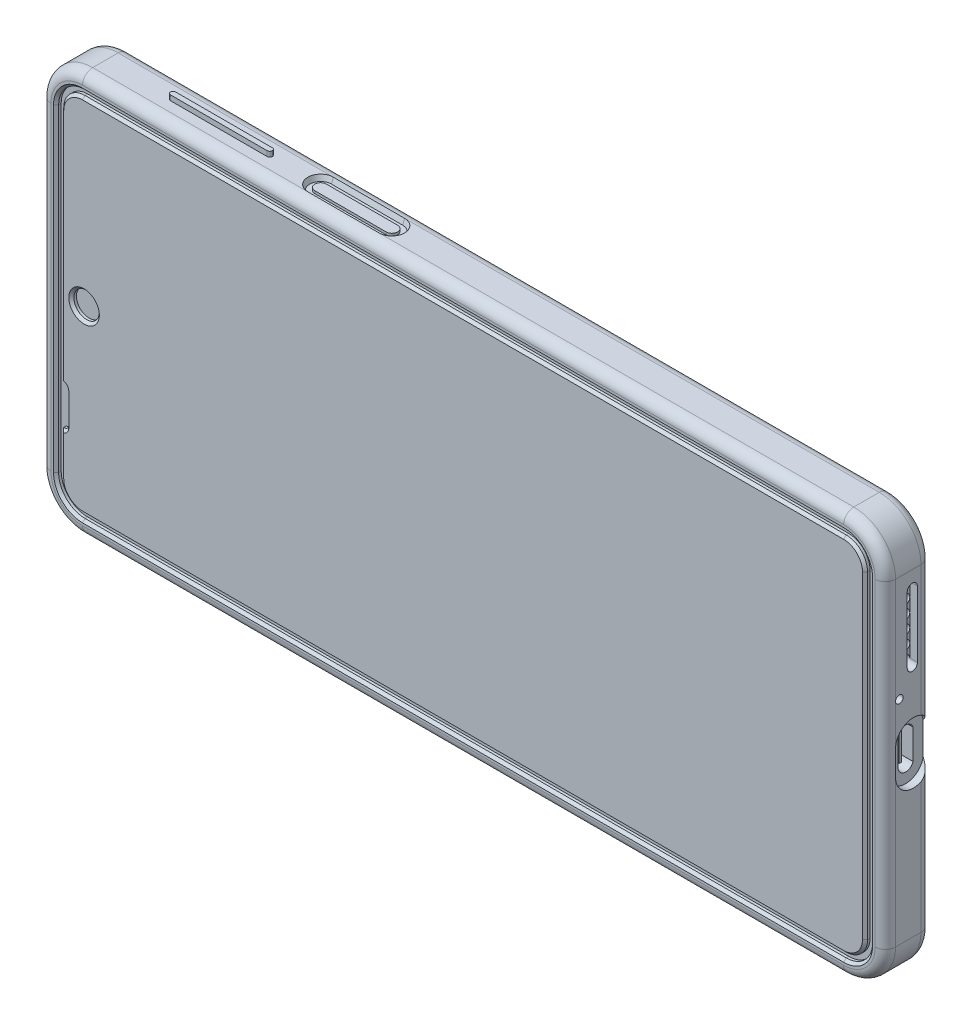
from build123d import *

# Parameters (mm, degrees)
SKETCH1_W           = 166
SKETCH1_H           = 79
BOSS_EXTRUDE1_DEPTH = 9
FILLET1_R           = 2
FILLET2_R           = 8.2
CUT_EXTRUDE1_DEPTH  = 1.5
CUT_EXTRUDE2_DEPTH  = 4
SKETCH4_W           = 0.5
SKETCH4_H           = 5.863693634
BOSS_EXTRUDE2_DEPTH = 3
CUT_EXTRUDE3_DEPTH  = 1.5
SKETCH6_R           = 1
CUT_EXTRUDE4_DEPTH  = 4
SKETCH7_R           = 0.75
CUT_EXTRUDE5_DEPTH  = 1.5
BOSS_EXTRUDE3_DEPTH = 1
SKETCH9_R           = 0.75
CUT_EXTRUDE6_DEPTH  = 1.5
CUT_EXTRUDE7_DEPTH  = 1
SKETCH11_R          = 2.5
CUT_EXTRUDE8_DEPTH  = 1
BOSS_EXTRUDE4_DEPTH = 3
CUT_EXTRUDE9_DEPTH  = 3
FILLET5_R           = 1
FILLET6_R           = 1
BOSS_EXTRUDE5_START = 1
BOSS_EXTRUDE5_DEPTH = 1
SKETCH15_R          = 6.5
BOSS_EXTRUDE6_DEPTH = 1
SKETCH16_R          = 1
CUT_EXTRUDE10_DEPTH = 0.1
CUT_EXTRUDE11_DEPTH = 0.1
BOSS_EXTRUDE7_DEPTH = 1
CUT_EXTRUDE12_DEPTH = 1
CUT_EXTRUDE12_DRAFT = -20
BOSS_EXTRUDE8_DEPTH = 0.5


# Some blends are built 0.0001 mm under size
with BuildPart() as part:
    # Sketch1 → Boss-Extrude1 (new body)
    with BuildSketch(Plane.XY):
        Rectangle(SKETCH1_W, SKETCH1_H)
    extrude(amount=BOSS_EXTRUDE1_DEPTH)

    # Fillet1
    fillet1_edges = [part.edges().sort_by_distance(p)[0] for p in [
        (-83, 0, 9),
        (0, -39.5, 9),
        (83, 0, 9),
        (0, -39.5, 0),
        (-83, 0, 0),
        (0, 39.5, 0),
        (83, 0, 0),
        (0, 39.5, 9),
    ]]
    fillet(fillet1_edges, radius=FILLET1_R)

    # Fillet2
    # the kernel refuses this fillet: 8.2 mm, written as the material it takes off along each edge
    with BuildSketch(Plane(origin=(74.8, -31.3, 0), x_dir=(1, 0, 0), z_dir=(0, 1, 0))) as fillet2_piece_1:
        with BuildLine():
            CenterArc((6.2, -2), 2, 0, 90)
            Line((8.2, -2), (8.2, 0))
            Line((8.2, 0), (6.2, 0))
        make_face()
    revolve(axis=Axis((74.8, -31.3, 0), (0, 0, -1)), revolution_arc=90, mode=Mode.SUBTRACT)
    with BuildSketch(Plane(origin=(-74.8, -31.3, 0), x_dir=(0, -1, 0), z_dir=(1, 0, 0))) as fillet2_piece_2:
        with BuildLine():
            CenterArc((6.2, -2), 2, 0, 90)
            Line((8.2, -2), (8.2, 0))
            Line((8.2, 0), (6.2, 0))
        make_face()
    revolve(axis=Axis((-74.8, -31.3, 0), (0, 0, -1)), revolution_arc=90, mode=Mode.SUBTRACT)
    with BuildSketch(Plane(origin=(74.8, 31.3, 0), x_dir=(0, 1, 0), z_dir=(-1, 0, 0))) as fillet2_piece_3:
        with BuildLine():
            CenterArc((6.2, -2), 2, 0, 90)
            Line((8.2, -2), (8.2, 0))
            Line((8.2, 0), (6.2, 0))
        make_face()
    revolve(axis=Axis((74.8, 31.3, 0), (0, 0, -1)), revolution_arc=90, mode=Mode.SUBTRACT)
    with BuildSketch(Plane(origin=(-74.8, 31.3, 0), x_dir=(-1, 0, 0), z_dir=(0, -1, 0))) as fillet2_piece_4:
        with BuildLine():
            CenterArc((6.2, -2), 2, 0, 90)
            Line((8.2, -2), (8.2, 0))
            Line((8.2, 0), (6.2, 0))
        make_face()
    revolve(axis=Axis((-74.8, 31.3, 0), (0, 0, -1)), revolution_arc=90, mode=Mode.SUBTRACT)
    with BuildSketch(Plane(origin=(-74.8, 31.3, 9), x_dir=(0, 1, 0), z_dir=(1, 0, 0))) as fillet2_piece_5:
        with BuildLine():
            CenterArc((6.2, -2), 2, 0, 90)
            Line((8.2, -2), (8.2, 0))
            Line((8.2, 0), (6.2, 0))
        make_face()
    revolve(axis=Axis((-74.8, 31.3, 9), (0, 0, 1)), revolution_arc=90, mode=Mode.SUBTRACT)
    with BuildSketch(Plane(origin=(74.8, 31.3, 9), x_dir=(1, 0, 0), z_dir=(0, -1, 0))) as fillet2_piece_6:
        with BuildLine():
            CenterArc((6.2, -2), 2, 0, 90)
            Line((8.2, -2), (8.2, 0))
            Line((8.2, 0), (6.2, 0))
        make_face()
    revolve(axis=Axis((74.8, 31.3, 9), (0, 0, 1)), revolution_arc=90, mode=Mode.SUBTRACT)
    with BuildSketch(Plane(origin=(-74.8, -31.3, 9), x_dir=(-1, 0, 0), z_dir=(0, 1, 0))) as fillet2_piece_7:
        with BuildLine():
            CenterArc((6.2, -2), 2, 0, 90)
            Line((8.2, -2), (8.2, 0))
            Line((8.2, 0), (6.2, 0))
        make_face()
    revolve(axis=Axis((-74.8, -31.3, 9), (0, 0, 1)), revolution_arc=90, mode=Mode.SUBTRACT)
    with BuildSketch(Plane(origin=(74.8, -31.3, 9), x_dir=(0, -1, 0), z_dir=(-1, 0, 0))) as fillet2_piece_8:
        with BuildLine():
            CenterArc((6.2, -2), 2, 0, 90)
            Line((8.2, -2), (8.2, 0))
            Line((8.2, 0), (6.2, 0))
        make_face()
    revolve(axis=Axis((74.8, -31.3, 9), (0, 0, 1)), revolution_arc=90, mode=Mode.SUBTRACT)
    with BuildSketch(Plane(origin=(-83, 39.5, 0), x_dir=(0, -1, 0), z_dir=(0, 0, 1)), Plane(origin=(-83, -39.5, 0), x_dir=(1, 0, 0), z_dir=(0, 0, 1))) as fillet2_piece_9:
        with BuildLine():
            CenterArc((FILLET2_R, FILLET2_R), FILLET2_R, 180, 90)
            Line((0, FILLET2_R), (0, 0))
            Line((0, 0), (FILLET2_R, 0))
        make_face()
    extrude(amount=9, mode=Mode.SUBTRACT)
    with BuildSketch(Plane(origin=(83, 39.5, 0), x_dir=(0, -1, 0), z_dir=(0, 0, 1)), Plane(origin=(83, -39.5, 0), x_dir=(-1, 0, 0), z_dir=(0, 0, 1))) as fillet2_piece_10:
        with BuildLine():
            CenterArc((FILLET2_R, -FILLET2_R), FILLET2_R, 90, 90)
            Line((0, -FILLET2_R), (0, 0))
            Line((0, 0), (FILLET2_R, 0))
        make_face()
    extrude(amount=9, mode=Mode.SUBTRACT)

    # Sketch2 → Cut-Extrude1 (cut)
    with BuildSketch(Plane(origin=(83, 0, 0), x_dir=(0, 0, -1), z_dir=(1, 0, 0))):
        with BuildLine():
            Line((0, 2.5), (0, -2.5))
            ThreePointArc((0, -2.5), (-3.5, -6), (-7, -2.5))
            Line((-7, -2.5), (-7, 2.5))
            ThreePointArc((-7, 2.5), (-3.5, 6), (0, 2.5))
        make_face()
    extrude(amount=-CUT_EXTRUDE1_DEPTH, mode=Mode.SUBTRACT)

    # Sketch3 → Cut-Extrude2 (cut)
    with BuildSketch(Plane(origin=(81.5, 0, 0), x_dir=(0, 0, -1), z_dir=(1, 0, 0))):
        with BuildLine():
            Line((-5, 2.5), (-5, -2.5))
            ThreePointArc((-5, -2.5), (-3.718245837, -3.98403799), (-2.063508327, -2.931846817))
            Line((-2.063508327, -2.931846817), (-2.063508327, 2.931846817))
            ThreePointArc((-2.063508327, 2.931846817), (-3.718245837, 3.98403799), (-5, 2.5))
        make_face()
    extrude(amount=-CUT_EXTRUDE2_DEPTH, mode=Mode.SUBTRACT)

    # Sketch4 → Boss-Extrude2 (add)
    with BuildSketch(Plane(origin=(77.5, 0, 0), x_dir=(0, 0, -1), z_dir=(1, 0, 0))):
        with Locations((-3.531754163, 0)):
            Rectangle(SKETCH4_W, SKETCH4_H)
    extrude(amount=BOSS_EXTRUDE2_DEPTH)

    # Sketch5 → Cut-Extrude3 (cut)
    with BuildSketch(Plane(origin=(83, 0, 0), x_dir=(0, 0, -1), z_dir=(1, 0, 0))):
        with BuildLine():
            Line((-2.7, 27.984086742), (-2.7, 14.984086742))
            ThreePointArc((-2.7, 14.984086742), (-3.7, 13.984086742), (-4.7, 14.984086742))
            Line((-4.7, 14.984086742), (-4.7, 27.984086742))
            ThreePointArc((-4.7, 27.984086742), (-3.7, 28.984086742), (-2.7, 27.984086742))
        make_face()
    extrude(amount=-CUT_EXTRUDE3_DEPTH, mode=Mode.SUBTRACT)

    # Sketch6 → Cut-Extrude4 (cut)
    with BuildSketch(Plane(origin=(81.5, 0, 0), x_dir=(0, 0, -1), z_dir=(1, 0, 0))):
        with Locations((-3.7, 27.984086742)):
            Circle(SKETCH6_R)
        with Locations((-3.7, 25.384086742)):
            Circle(SKETCH6_R)
        with Locations((-3.7, 22.784086742)):
            Circle(SKETCH6_R)
        with Locations((-3.7, 20.184086742)):
            Circle(SKETCH6_R)
        with Locations((-3.7, 17.584086742)):
            Circle(SKETCH6_R)
        with Locations((-3.7, 14.984086742)):
            Circle(SKETCH6_R)
    extrude(amount=-CUT_EXTRUDE4_DEPTH, mode=Mode.SUBTRACT)

    # Sketch7 → Cut-Extrude5 (cut)
    with BuildSketch(Plane(origin=(83, 0, 0), x_dir=(0, 0, -1), z_dir=(1, 0, 0))):
        with Locations((-6.25, 10.484086742)):
            Circle(SKETCH7_R)
    extrude(amount=-CUT_EXTRUDE5_DEPTH, mode=Mode.SUBTRACT)

    # Sketch8 → Boss-Extrude3 (add)
    with BuildSketch(Plane.XZ.offset(39.5)):
        with BuildLine():
            Line((-42, 5.5), (-34.5, 5.5))
            ThreePointArc((-34.5, 5.5), (-33.5, 4.5), (-34.5, 3.5))
            Line((-34.5, 3.5), (-42, 3.5))
            ThreePointArc((-42, 3.5), (-43, 4.5), (-42, 5.5))
        make_face()
    extrude(amount=BOSS_EXTRUDE3_DEPTH)

    # Sketch9 → Cut-Extrude6 (cut)
    with BuildSketch(Plane.ZY.offset(83)):
        with Locations((6.25, -25.85)):
            Circle(SKETCH9_R)
    extrude(amount=-CUT_EXTRUDE6_DEPTH, mode=Mode.SUBTRACT)

    # Sketch10 → Cut-Extrude7 (cut)
    with BuildSketch(Plane.XY.offset(9)):
        with BuildLine():
            Line((74.8, 36.5), (-74.8, 36.5))
            ThreePointArc((-74.8, 36.5), (-78.476955262, 34.976955262), (-80, 31.3))
            Line((-80, 31.3), (-80, -31.3))
            ThreePointArc((-80, -31.3), (-78.476955262, -34.976955262), (-74.8, -36.5))
            Line((-74.8, -36.5), (74.8, -36.5))
            ThreePointArc((74.8, -36.5), (78.476955262, -34.976955262), (80, -31.3))
            Line((80, -31.3), (80, 31.3))
            ThreePointArc((80, 31.3), (78.476955262, 34.976955262), (74.8, 36.5))
        make_face()
        with BuildLine():
            Line((-79, -31.3), (-79, -23.1))
            Line((-79, -23.1), (-78.9, -23.1))
            ThreePointArc((-78.9, -23.1), (-78.263603897, -22.836396103), (-78, -22.2))
            Line((-78, -22.2), (-78, -16))
            ThreePointArc((-78, -16), (-78.263603897, -15.363603897), (-78.9, -15.1))
            Line((-78.9, -15.1), (-79, -15.1))
            Line((-79, -15.1), (-79, 31.3))
            ThreePointArc((-79, 31.3), (-77.769848481, 34.269848481), (-74.8, 35.5))
            Line((-74.8, 35.5), (74.8, 35.5))
            ThreePointArc((74.8, 35.5), (77.769848481, 34.269848481), (79, 31.3))
            Line((79, 31.3), (79, -31.3))
            ThreePointArc((79, -31.3), (77.769848481, -34.269848481), (74.8, -35.5))
            Line((74.8, -35.5), (-74.8, -35.5))
            ThreePointArc((-74.8, -35.5), (-77.769848481, -34.269848481), (-79, -31.3))
        make_face(mode=Mode.SUBTRACT)
    extrude(amount=-CUT_EXTRUDE7_DEPTH, mode=Mode.SUBTRACT)

    # Sketch11 → Cut-Extrude8 (cut)
    with BuildSketch(Plane.XY.offset(9)):
        with Locations((-74.5, 0)):
            Circle(SKETCH11_R)
    extrude(amount=-CUT_EXTRUDE8_DEPTH, mode=Mode.SUBTRACT)

    # Fillet4
    # the kernel refuses this chamfer: 0.5 mm, written as the material it takes off along each edge
    with BuildSketch(Plane(origin=(74.8, -31.3, 9), x_dir=(0, -1, 0), z_dir=(-1, 0, 0))) as fillet4_piece_1:
        with BuildLine():
            Line((5.714142136, 0.014142136), (5.185857864, -0.514142136))
            Line((5.185857864, -0.514142136), (5.175857864, -0.514142136))
            ThreePointArc((5.175857864, -0.514142136), (5.19, -0.257071068), (5.19, 0))
            Line((5.19, 0), (5.2, 0.01))
            ThreePointArc((5.2, 0.01), (5.457071068, 0.01), (5.714142136, 0.024142136))
            Line((5.714142136, 0.024142136), (5.714142136, 0.014142136))
        make_face()
    revolve(axis=Axis((74.8, -31.3, 9), (0, 0, 1)), revolution_arc=90, mode=Mode.SUBTRACT)
    with BuildSketch(Plane(origin=(80, -31.3, 9), x_dir=(0.9996219169112968, 0, 0.02749587661058574), z_dir=(0, 1, 0)), Plane(origin=(-80, 31.3, 9), x_dir=(-0.9996219169112968, 0, 0.02749587661058574), z_dir=(0, -1, 0))) as fillet4_piece_2:
        with BuildLine():
            Line((0.514336598, 0), (-0.028273577, 0.513558897))
            Line((-0.028273577, 0.513558897), (-0.038269797, 0.513283938))
            ThreePointArc((-0.038269797, 0.513283938), (-0.017064614, 0.256698915), (-0.009996219, -0.000274959))
            Line((-0.009996219, -0.000274959), (0.000274959, -0.009996219))
            ThreePointArc((0.000274959, -0.009996219), (0.257248832, -0.002927825), (0.514611556, -0.009996219))
            Line((0.514611556, -0.009996219), (0.514336598, 0))
        make_face()
    extrude(amount=62.6, mode=Mode.SUBTRACT)
    with BuildSketch(Plane(origin=(74.8, 31.3, 9), x_dir=(1, 0, 0), z_dir=(0, -1, 0))) as fillet4_piece_3:
        with BuildLine():
            Line((5.714142136, 0.014142136), (5.185857864, -0.514142136))
            Line((5.185857864, -0.514142136), (5.175857864, -0.514142136))
            ThreePointArc((5.175857864, -0.514142136), (5.19, -0.257071068), (5.19, 0))
            Line((5.19, 0), (5.2, 0.01))
            ThreePointArc((5.2, 0.01), (5.457071068, 0.01), (5.714142136, 0.024142136))
            Line((5.714142136, 0.024142136), (5.714142136, 0.014142136))
        make_face()
    revolve(axis=Axis((74.8, 31.3, 9), (0, 0, 1)), revolution_arc=90, mode=Mode.SUBTRACT)
    with BuildSketch(Plane(origin=(74.8, 36.5, 9), x_dir=(0, 0.9996219169112968, 0.02749587661058574), z_dir=(-1, 0, 0)), Plane(origin=(-74.8, -36.5, 9), x_dir=(0, -0.9996219169112968, 0.02749587661058574), z_dir=(1, 0, 0))) as fillet4_piece_4:
        with BuildLine():
            Line((0.514336598, 0), (-0.028273577, 0.513558897))
            Line((-0.028273577, 0.513558897), (-0.038269797, 0.513283938))
            ThreePointArc((-0.038269797, 0.513283938), (-0.017064614, 0.256698915), (-0.009996219, -0.000274959))
            Line((-0.009996219, -0.000274959), (0.000274959, -0.009996219))
            ThreePointArc((0.000274959, -0.009996219), (0.257248832, -0.002927825), (0.514611556, -0.009996219))
            Line((0.514611556, -0.009996219), (0.514336598, 0))
        make_face()
    extrude(amount=149.6, mode=Mode.SUBTRACT)
    with BuildSketch(Plane(origin=(-74.8, 31.3, 9), x_dir=(0, 1, 0), z_dir=(1, 0, 0))) as fillet4_piece_5:
        with BuildLine():
            Line((5.714142136, 0.014142136), (5.185857864, -0.514142136))
            Line((5.185857864, -0.514142136), (5.175857864, -0.514142136))
            ThreePointArc((5.175857864, -0.514142136), (5.19, -0.257071068), (5.19, 0))
            Line((5.19, 0), (5.2, 0.01))
            ThreePointArc((5.2, 0.01), (5.457071068, 0.01), (5.714142136, 0.024142136))
            Line((5.714142136, 0.024142136), (5.714142136, 0.014142136))
        make_face()
    revolve(axis=Axis((-74.8, 31.3, 9), (0, 0, 1)), revolution_arc=90, mode=Mode.SUBTRACT)
    with BuildSketch(Plane(origin=(-74.8, -31.3, 9), x_dir=(-1, 0, 0), z_dir=(0, 1, 0))) as fillet4_piece_6:
        with BuildLine():
            Line((5.714142136, 0.014142136), (5.185857864, -0.514142136))
            Line((5.185857864, -0.514142136), (5.175857864, -0.514142136))
            ThreePointArc((5.175857864, -0.514142136), (5.19, -0.257071068), (5.19, 0))
            Line((5.19, 0), (5.2, 0.01))
            ThreePointArc((5.2, 0.01), (5.457071068, 0.01), (5.714142136, 0.024142136))
            Line((5.714142136, 0.024142136), (5.714142136, 0.014142136))
        make_face()
    revolve(axis=Axis((-74.8, -31.3, 9), (0, 0, 1)), revolution_arc=90, mode=Mode.SUBTRACT)
    with BuildSketch(Plane(origin=(-79, -15.1, 9), x_dir=(-0.0274958766105822, 0, -0.999621916911297), z_dir=(0, 1, 0))) as fillet4_piece_7:
        with BuildLine():
            Line((0.514336598, 0), (-0.028273577, -0.513558897))
            Line((-0.028273577, -0.513558897), (-0.038269797, -0.513283938))
            ThreePointArc((-0.038269797, -0.513283938), (-0.017064614, -0.256698915), (-0.009996219, 0.000274959))
            Line((-0.009996219, 0.000274959), (0.000274959, 0.009996219))
            ThreePointArc((0.000274959, 0.009996219), (0.257248832, 0.002927825), (0.514611556, 0.009996219))
            Line((0.514611556, 0.009996219), (0.514336598, 0))
        make_face()
    extrude(amount=46.4, mode=Mode.SUBTRACT)
    with BuildSketch(Plane(origin=(-74.8, 31.3, 9), x_dir=(-1, 0, 0), z_dir=(0, -1, 0))) as fillet4_piece_8:
        with BuildLine():
            Line((4.214142136, 0.514142136), (3.685857864, -0.014142136))
            Line((3.685857864, -0.014142136), (3.685857864, -0.024142136))
            ThreePointArc((3.685857864, -0.024142136), (3.942928932, -0.01), (4.2, -0.01))
            Line((4.2, -0.01), (4.21, 0))
            ThreePointArc((4.21, 0), (4.21, 0.257071068), (4.224142136, 0.514142136))
            Line((4.224142136, 0.514142136), (4.214142136, 0.514142136))
        make_face()
    revolve(axis=Axis((-74.8, 31.3, 9), (0, 0, -1)), revolution_arc=90, mode=Mode.SUBTRACT)
    with BuildSketch(Plane(origin=(-74.8, 35.5, 9), x_dir=(0, 0.0274958766105822, -0.999621916911297), z_dir=(1, 0, 0)), Plane(origin=(74.8, -35.5, 9), x_dir=(0, -0.0274958766105822, -0.999621916911297), z_dir=(-1, 0, 0))) as fillet4_piece_9:
        with BuildLine():
            Line((0.514336598, 0), (-0.028273577, -0.513558897))
            Line((-0.028273577, -0.513558897), (-0.038269797, -0.513283938))
            ThreePointArc((-0.038269797, -0.513283938), (-0.017064614, -0.256698915), (-0.009996219, 0.000274959))
            Line((-0.009996219, 0.000274959), (0.000274959, 0.009996219))
            ThreePointArc((0.000274959, 0.009996219), (0.257248832, 0.002927825), (0.514611556, 0.009996219))
            Line((0.514611556, 0.009996219), (0.514336598, 0))
        make_face()
    extrude(amount=149.6, mode=Mode.SUBTRACT)
    with BuildSketch(Plane(origin=(74.8, 31.3, 9), x_dir=(0, 1, 0), z_dir=(-1, 0, 0))) as fillet4_piece_10:
        with BuildLine():
            Line((4.214142136, 0.514142136), (3.685857864, -0.014142136))
            Line((3.685857864, -0.014142136), (3.685857864, -0.024142136))
            ThreePointArc((3.685857864, -0.024142136), (3.942928932, -0.01), (4.2, -0.01))
            Line((4.2, -0.01), (4.21, 0))
            ThreePointArc((4.21, 0), (4.21, 0.257071068), (4.224142136, 0.514142136))
            Line((4.224142136, 0.514142136), (4.214142136, 0.514142136))
        make_face()
    revolve(axis=Axis((74.8, 31.3, 9), (0, 0, -1)), revolution_arc=90, mode=Mode.SUBTRACT)
    with BuildSketch(Plane(origin=(79, 31.3, 9), x_dir=(0.0274958766105822, 0, -0.999621916911297), z_dir=(0, -1, 0))) as fillet4_piece_11:
        with BuildLine():
            Line((0.514336598, 0), (-0.028273577, -0.513558897))
            Line((-0.028273577, -0.513558897), (-0.038269797, -0.513283938))
            ThreePointArc((-0.038269797, -0.513283938), (-0.017064614, -0.256698915), (-0.009996219, 0.000274959))
            Line((-0.009996219, 0.000274959), (0.000274959, 0.009996219))
            ThreePointArc((0.000274959, 0.009996219), (0.257248832, 0.002927825), (0.514611556, 0.009996219))
            Line((0.514611556, 0.009996219), (0.514336598, 0))
        make_face()
    extrude(amount=62.6, mode=Mode.SUBTRACT)
    with BuildSketch(Plane(origin=(74.8, -31.3, 9), x_dir=(1, 0, 0), z_dir=(0, 1, 0))) as fillet4_piece_12:
        with BuildLine():
            Line((4.214142136, 0.514142136), (3.685857864, -0.014142136))
            Line((3.685857864, -0.014142136), (3.685857864, -0.024142136))
            ThreePointArc((3.685857864, -0.024142136), (3.942928932, -0.01), (4.2, -0.01))
            Line((4.2, -0.01), (4.21, 0))
            ThreePointArc((4.21, 0), (4.21, 0.257071068), (4.224142136, 0.514142136))
            Line((4.224142136, 0.514142136), (4.214142136, 0.514142136))
        make_face()
    revolve(axis=Axis((74.8, -31.3, 9), (0, 0, -1)), revolution_arc=90, mode=Mode.SUBTRACT)
    with BuildSketch(Plane(origin=(-74.8, -31.3, 9), x_dir=(0, -1, 0), z_dir=(1, 0, 0))) as fillet4_piece_13:
        with BuildLine():
            Line((4.214142136, 0.514142136), (3.685857864, -0.014142136))
            Line((3.685857864, -0.014142136), (3.685857864, -0.024142136))
            ThreePointArc((3.685857864, -0.024142136), (3.942928932, -0.01), (4.2, -0.01))
            Line((4.2, -0.01), (4.21, 0))
            ThreePointArc((4.21, 0), (4.21, 0.257071068), (4.224142136, 0.514142136))
            Line((4.224142136, 0.514142136), (4.214142136, 0.514142136))
        make_face()
    revolve(axis=Axis((-74.8, -31.3, 9), (0, 0, -1)), revolution_arc=90, mode=Mode.SUBTRACT)
    with BuildSketch(Plane(origin=(-79, -31.3, 9), x_dir=(-0.0274958766105822, 0, -0.999621916911297), z_dir=(0, 1, 0))) as fillet4_piece_14:
        with BuildLine():
            Line((0.514336598, 0), (-0.028273577, -0.513558897))
            Line((-0.028273577, -0.513558897), (-0.038269797, -0.513283938))
            ThreePointArc((-0.038269797, -0.513283938), (-0.017064614, -0.256698915), (-0.009996219, 0.000274959))
            Line((-0.009996219, 0.000274959), (0.000274959, 0.009996219))
            ThreePointArc((0.000274959, 0.009996219), (0.257248832, 0.002927825), (0.514611556, 0.009996219))
            Line((0.514611556, 0.009996219), (0.514336598, 0))
        make_face()
    extrude(amount=8.2, mode=Mode.SUBTRACT)
    with BuildSketch(Plane(origin=(-78.9, -22.2, 9), x_dir=(0, -1, 0), z_dir=(-1, 0, 0))) as fillet4_piece_15:
        with BuildLine():
            Line((0.885857864, -0.514142136), (1.414142136, 0.014142136))
            Line((1.414142136, 0.014142136), (1.414142136, 0.024142136))
            ThreePointArc((1.414142136, 0.024142136), (1.157071068, 0.01), (0.9, 0.01))
            Line((0.9, 0.01), (0.89, 0))
            ThreePointArc((0.89, 0), (0.89, -0.257071068), (0.875857864, -0.514142136))
            Line((0.875857864, -0.514142136), (0.885857864, -0.514142136))
        make_face()
    revolve(axis=Axis((-78.9, -22.2, 9), (0, 0, 1)), revolution_arc=90, mode=Mode.SUBTRACT)
    with BuildSketch(Plane(origin=(-78, -22.2, 9), x_dir=(-0.0274958766105822, 0, -0.999621916911297), z_dir=(0, 1, 0))) as fillet4_piece_16:
        with BuildLine():
            Line((0.514336598, 0), (-0.028273577, -0.513558897))
            Line((-0.028273577, -0.513558897), (-0.038269797, -0.513283938))
            ThreePointArc((-0.038269797, -0.513283938), (-0.017064614, -0.256698915), (-0.009996219, 0.000274959))
            Line((-0.009996219, 0.000274959), (0.000274959, 0.009996219))
            ThreePointArc((0.000274959, 0.009996219), (0.257248832, 0.002927825), (0.514611556, 0.009996219))
            Line((0.514611556, 0.009996219), (0.514336598, 0))
        make_face()
    extrude(amount=6.2, mode=Mode.SUBTRACT)
    with BuildSketch(Plane(origin=(-78.9, -16, 9), x_dir=(1, 0, 0), z_dir=(0, -1, 0))) as fillet4_piece_17:
        with BuildLine():
            Line((0.885857864, -0.514142136), (1.414142136, 0.014142136))
            Line((1.414142136, 0.014142136), (1.414142136, 0.024142136))
            ThreePointArc((1.414142136, 0.024142136), (1.157071068, 0.01), (0.9, 0.01))
            Line((0.9, 0.01), (0.89, 0))
            ThreePointArc((0.89, 0), (0.89, -0.257071068), (0.875857864, -0.514142136))
            Line((0.875857864, -0.514142136), (0.885857864, -0.514142136))
        make_face()
    revolve(axis=Axis((-78.9, -16, 9), (0, 0, 1)), revolution_arc=90, mode=Mode.SUBTRACT)
    with BuildSketch(Plane(origin=(-74.5, 0, 9), x_dir=(1, 0, 0), z_dir=(0, -1, 0))) as fillet4_piece_18:
        with BuildLine():
            Line((3.014142136, 0.014142136), (2.485857864, -0.514142136))
            Line((2.485857864, -0.514142136), (2.475857864, -0.514142136))
            ThreePointArc((2.475857864, -0.514142136), (2.49, -0.257071068), (2.49, 0))
            Line((2.49, 0), (2.5, 0.01))
            ThreePointArc((2.5, 0.01), (2.757071068, 0.01), (3.014142136, 0.024142136))
            Line((3.014142136, 0.024142136), (3.014142136, 0.014142136))
        make_face()
    revolve(axis=Axis((-74.5, 0, 9), (0, 0, 1)), mode=Mode.SUBTRACT)
    with BuildSketch(Plane(origin=(-78.9, -15.1, 9), x_dir=(0, -0.027495876610585647, -0.9996219169112968), z_dir=(-1, 0, 0)), Plane(origin=(-79, -23.1, 9), x_dir=(0, 0.0274958766105891, -0.9996219169112968), z_dir=(1, 0, 0))) as fillet4_piece_19:
        with BuildLine():
            Line((0.514336598, 0), (-0.028273577, -0.513558897))
            Line((-0.028273577, -0.513558897), (-0.038269797, -0.513283938))
            ThreePointArc((-0.038269797, -0.513283938), (-0.017064614, -0.256698915), (-0.009996219, 0.000274959))
            Line((-0.009996219, 0.000274959), (0.000274959, 0.009996219))
            ThreePointArc((0.000274959, 0.009996219), (0.257248832, 0.002927825), (0.514611556, 0.009996219))
            Line((0.514611556, 0.009996219), (0.514336598, 0))
        make_face()
    extrude(amount=0.1, mode=Mode.SUBTRACT)
    with BuildSketch(Plane(origin=(-78.9, -15.1, 9), x_dir=(0, -0.027495876610585647, -0.9996219169112968), z_dir=(-1, 0, 0))) as fillet4_piece_20a_section:
        with BuildLine():
            Line((0.514336598, 0), (-0.028273577, -0.513558897))
            Line((-0.028273577, -0.513558897), (-0.038269797, -0.513283938))
            ThreePointArc((-0.038269797, -0.513283938), (-0.017064614, -0.256698915), (-0.009996219, 0.000274959))
            Line((-0.009996219, 0.000274959), (0.000274959, 0.009996219))
            ThreePointArc((0.000274959, 0.009996219), (0.257248832, 0.002927825), (0.514611556, 0.009996219))
            Line((0.514611556, 0.009996219), (0.514336598, 0))
        make_face()
    fillet4_piece_20a = extrude(amount=1.385841494, mode=Mode.PRIVATE)
    fillet4_piece_20a = split(fillet4_piece_20a, bisect_by=Plane(origin=(-79, -14.935103187, 8.835103187), z_dir=(-1, 0, 0)), keep=Keep.TOP, mode=Mode.PRIVATE)
    with BuildSketch(Plane(origin=(-79, -16.385841494, 9), x_dir=(-0.0274958766105822, 0, -0.999621916911297), z_dir=(0, 1, 0))) as fillet4_piece_20b_section:
        with BuildLine():
            Line((0.514336598, 0), (-0.028273577, -0.513558897))
            Line((-0.028273577, -0.513558897), (-0.038269797, -0.513283938))
            ThreePointArc((-0.038269797, -0.513283938), (-0.017064614, -0.256698915), (-0.009996219, 0.000274959))
            Line((-0.009996219, 0.000274959), (0.000274959, 0.009996219))
            ThreePointArc((0.000274959, 0.009996219), (0.257248832, 0.002927825), (0.514611556, 0.009996219))
            Line((0.514611556, 0.009996219), (0.514336598, 0))
        make_face()
    fillet4_piece_20b = extrude(amount=47.685841494, mode=Mode.PRIVATE)
    fillet4_piece_20b = split(fillet4_piece_20b, bisect_by=Plane(origin=(-78.835103187, -15.1, 8.835103187), z_dir=(0, -1, 0)), keep=Keep.TOP, mode=Mode.PRIVATE)
    fillet4_piece_20 = fillet4_piece_20a & fillet4_piece_20b
    add(fillet4_piece_20, mode=Mode.SUBTRACT)
    with BuildSketch(Plane(origin=(-79, -31.3, 9), x_dir=(-0.0274958766105822, 0, -0.999621916911297), z_dir=(0, 1, 0))) as fillet4_piece_21a_section:
        with BuildLine():
            Line((0.514336598, 0), (-0.028273577, -0.513558897))
            Line((-0.028273577, -0.513558897), (-0.038269797, -0.513283938))
            ThreePointArc((-0.038269797, -0.513283938), (-0.017064614, -0.256698915), (-0.009996219, 0.000274959))
            Line((-0.009996219, 0.000274959), (0.000274959, 0.009996219))
            ThreePointArc((0.000274959, 0.009996219), (0.257248832, 0.002927825), (0.514611556, 0.009996219))
            Line((0.514611556, 0.009996219), (0.514336598, 0))
        make_face()
    fillet4_piece_21a = extrude(amount=9.485841494, mode=Mode.PRIVATE)
    fillet4_piece_21a = split(fillet4_piece_21a, bisect_by=Plane(origin=(-78.835103187, -23.1, 8.835103187), z_dir=(0, 1, 0)), keep=Keep.TOP, mode=Mode.PRIVATE)
    with BuildSketch(Plane(origin=(-80.285841494, -23.1, 9), x_dir=(0, 0.0274958766105891, -0.9996219169112968), z_dir=(1, 0, 0))) as fillet4_piece_21b_section:
        with BuildLine():
            Line((0.514336598, 0), (-0.028273577, -0.513558897))
            Line((-0.028273577, -0.513558897), (-0.038269797, -0.513283938))
            ThreePointArc((-0.038269797, -0.513283938), (-0.017064614, -0.256698915), (-0.009996219, 0.000274959))
            Line((-0.009996219, 0.000274959), (0.000274959, 0.009996219))
            ThreePointArc((0.000274959, 0.009996219), (0.257248832, 0.002927825), (0.514611556, 0.009996219))
            Line((0.514611556, 0.009996219), (0.514336598, 0))
        make_face()
    fillet4_piece_21b = extrude(amount=1.385841494, mode=Mode.PRIVATE)
    fillet4_piece_21b = split(fillet4_piece_21b, bisect_by=Plane(origin=(-79, -23.264896813, 8.835103187), z_dir=(-1, 0, 0)), keep=Keep.TOP, mode=Mode.PRIVATE)
    fillet4_piece_21 = fillet4_piece_21a & fillet4_piece_21b
    add(fillet4_piece_21, mode=Mode.SUBTRACT)

    # Sketch12 → Boss-Extrude4 (add)
    with BuildSketch(Plane(origin=(0, 0, 0), x_dir=(-1, 0, 0), z_dir=(0, 0, -1))):
        with BuildLine():
            Line((32, 5.5), (72, 5.5))
            ThreePointArc((72, 5.5), (75.535533906, 6.964466094), (77, 10.5))
            Line((77, 10.5), (77, 28.5))
            ThreePointArc((77, 28.5), (75.535533906, 32.035533906), (72, 33.5))
            Line((72, 33.5), (32, 33.5))
            ThreePointArc((32, 33.5), (28.464466094, 32.035533906), (27, 28.5))
            Line((27, 28.5), (27, 10.5))
            ThreePointArc((27, 10.5), (28.464466094, 6.964466094), (32, 5.5))
        make_face()
    extrude(amount=BOSS_EXTRUDE4_DEPTH)

    # Sketch13 → Cut-Extrude9 (cut)
    with BuildSketch(Plane(origin=(0, 0, -3), x_dir=(-1, 0, 0), z_dir=(0, 0, -1))):
        with BuildLine():
            Line((32, 7.5), (72, 7.5))
            ThreePointArc((72, 7.5), (74.121320344, 8.378679656), (75, 10.5))
            Line((75, 10.5), (75, 28.5))
            ThreePointArc((75, 28.5), (74.121320344, 30.621320344), (72, 31.5))
            Line((72, 31.5), (32, 31.5))
            ThreePointArc((32, 31.5), (29.878679656, 30.621320344), (29, 28.5))
            Line((29, 28.5), (29, 10.5))
            ThreePointArc((29, 10.5), (29.878679656, 8.378679656), (32, 7.5))
        make_face()
    extrude(amount=-CUT_EXTRUDE9_DEPTH, mode=Mode.SUBTRACT)

    # Fillet5
    fillet5_edges = [part.edges().sort_by_distance(p)[0] for p in [
        (-28.464466094, 6.964466094, 0),
        (-52, 5.5, 0),
        (-75.535533906, 6.964466094, 0),
        (-77, 19.5, 0),
        (-75.535533906, 32.035533906, 0),
        (-52, 33.5, 0),
        (-28.464466094, 32.035533906, 0),
        (-27, 19.5, 0),
    ]]
    fillet(fillet5_edges, radius=FILLET5_R)

    # Fillet6
    fillet6_edges = [part.edges().sort_by_distance(p)[0] for p in [
        (-28.464466094, 6.964466094, -3),
        (-52, 5.5, -3),
        (-75.535533906, 6.964466094, -3),
        (-77, 19.5, -3),
        (-75.535533906, 32.035533906, -3),
        (-52, 33.5, -3),
        (-28.464466094, 32.035533906, -3),
        (-27, 19.5, -3),
        (-29.878679656, 8.378679656, -3),
        (-52, 7.5, -3),
        (-74.121320344, 8.378679656, -3),
        (-75, 19.5, -3),
        (-74.121320344, 30.621320344, -3),
        (-52, 31.5, -3),
        (-29.878679656, 30.621320344, -3),
        (-29, 19.5, -3),
    ]]
    fillet(fillet6_edges, radius=FILLET6_R - 0.0001)  # a hair under: the kernel refuses the full size

    # Sketch14 → Boss-Extrude5 (add)
    with BuildSketch(Plane(origin=(0, 0, 0), x_dir=(-1, 0, 0), z_dir=(0, 0, -1)).offset(BOSS_EXTRUDE5_START)):
        with BuildLine():
            Line((32, 31.5), (72, 31.5))
            ThreePointArc((72, 31.5), (74.121320344, 30.621320344), (75, 28.5))
            Line((75, 28.5), (75, 18.5))
            ThreePointArc((75, 18.5), (74.121320344, 16.378679656), (72, 15.5))
            Line((72, 15.5), (32, 15.5))
            ThreePointArc((32, 15.5), (29.878679656, 16.378679656), (29, 18.5))
            Line((29, 18.5), (29, 28.5))
            ThreePointArc((29, 28.5), (29.878679656, 30.621320344), (32, 31.5))
        make_face()
    extrude(amount=-BOSS_EXTRUDE5_DEPTH)

    # Sketch15 → Boss-Extrude6 (add)
    with BuildSketch(Plane(origin=(0, 0, -1), x_dir=(-1, 0, 0), z_dir=(0, 0, -1))):
        with Locations((37, 23.5)):
            Circle(SKETCH15_R)
        with Locations((52, 23.5)):
            Circle(SKETCH15_R)
        with Locations((67, 23.5)):
            Circle(SKETCH15_R)
    extrude(amount=BOSS_EXTRUDE6_DEPTH)

    # Sketch16 → Cut-Extrude10 (cut)
    with BuildSketch(Plane(origin=(0, 0, 0), x_dir=(-1, 0, 0), z_dir=(0, 0, -1))):
        with Locations((67, 12)):
            Circle(SKETCH16_R)
    extrude(amount=-CUT_EXTRUDE10_DEPTH, mode=Mode.SUBTRACT)

    # Sketch17 → Cut-Extrude11 (cut)
    with BuildSketch(Plane(origin=(0, 0, 0), x_dir=(-1, 0, 0), z_dir=(0, 0, -1))):
        with BuildLine():
            Line((33.5, 13), (41.5, 13))
            ThreePointArc((41.5, 13), (43, 11.5), (41.5, 10))
            Line((41.5, 10), (33.5, 10))
            ThreePointArc((33.5, 10), (32, 11.5), (33.5, 13))
        make_face()
    extrude(amount=-CUT_EXTRUDE11_DEPTH, mode=Mode.SUBTRACT)

    # Sketch18 → Boss-Extrude7 (add)
    with BuildSketch(Plane(origin=(0, 39.5, 0), x_dir=(1, 0, 0), z_dir=(0, 1, 0))):
        with BuildLine():
            Line((-61.5, -4), (-42.5, -4))
            ThreePointArc((-42.5, -4), (-42, -4.5), (-42.5, -5))
            Line((-42.5, -5), (-61.5, -5))
            ThreePointArc((-61.5, -5), (-62, -4.5), (-61.5, -4))
        make_face()
    extrude(amount=BOSS_EXTRUDE7_DEPTH)


with BuildPart() as cut_extrude12_tool:
    # Sketch19 → Cut-Extrude12 (with draft: the straight prism first)
    with BuildSketch(Plane(origin=(0, 39.5, 0), x_dir=(1, 0, 0), z_dir=(0, 1, 0))):
        with BuildLine():
            ThreePointArc((-32.5, -2), (-35, -4.5), (-32.5, -7))
            Line((-32.5, -7), (-18.5, -7))
            ThreePointArc((-18.5, -7), (-16, -4.5), (-18.5, -2))
            Line((-18.5, -2), (-32.5, -2))
        make_face()
    extrude(amount=-CUT_EXTRUDE12_DEPTH)
    # Cut-Extrude12: the draft: its side faces are tilted about the plane it starts from
    cut_extrude12_sides = [cut_extrude12_tool.faces().sort_by_distance(p)[0] for p in [
        (-35, 39, 4.5),
        (-25.5, 39, 7),
        (-16, 39, 4.5),
        (-25.5, 39, 2),
    ]]
    draft(cut_extrude12_sides, Plane(origin=(0, 39.5, 0), x_dir=(1, 0, 0), z_dir=(0, 1, 0)), CUT_EXTRUDE12_DRAFT)


with BuildPart() as part_1:
    add(part.part)

    # Cut-Extrude12: cut by cut_extrude12_tool
    add(cut_extrude12_tool.part, mode=Mode.SUBTRACT)

    # Sketch20 → Boss-Extrude8 (add)
    with BuildSketch(Plane(origin=(0, 38.5, 0), x_dir=(1, 0, 0), z_dir=(0, 1, 0))):
        with BuildLine():
            Line((-32.5, -5.636029766), (-18.5, -5.636029766))
            ThreePointArc((-18.5, -5.636029766), (-17.363970234, -4.5), (-18.5, -3.363970234))
            Line((-18.5, -3.363970234), (-32.5, -3.363970234))
            ThreePointArc((-32.5, -3.363970234), (-33.636029766, -4.5), (-32.5, -5.636029766))
        make_face()
    extrude(amount=BOSS_EXTRUDE8_DEPTH)


solid = part_1.part
